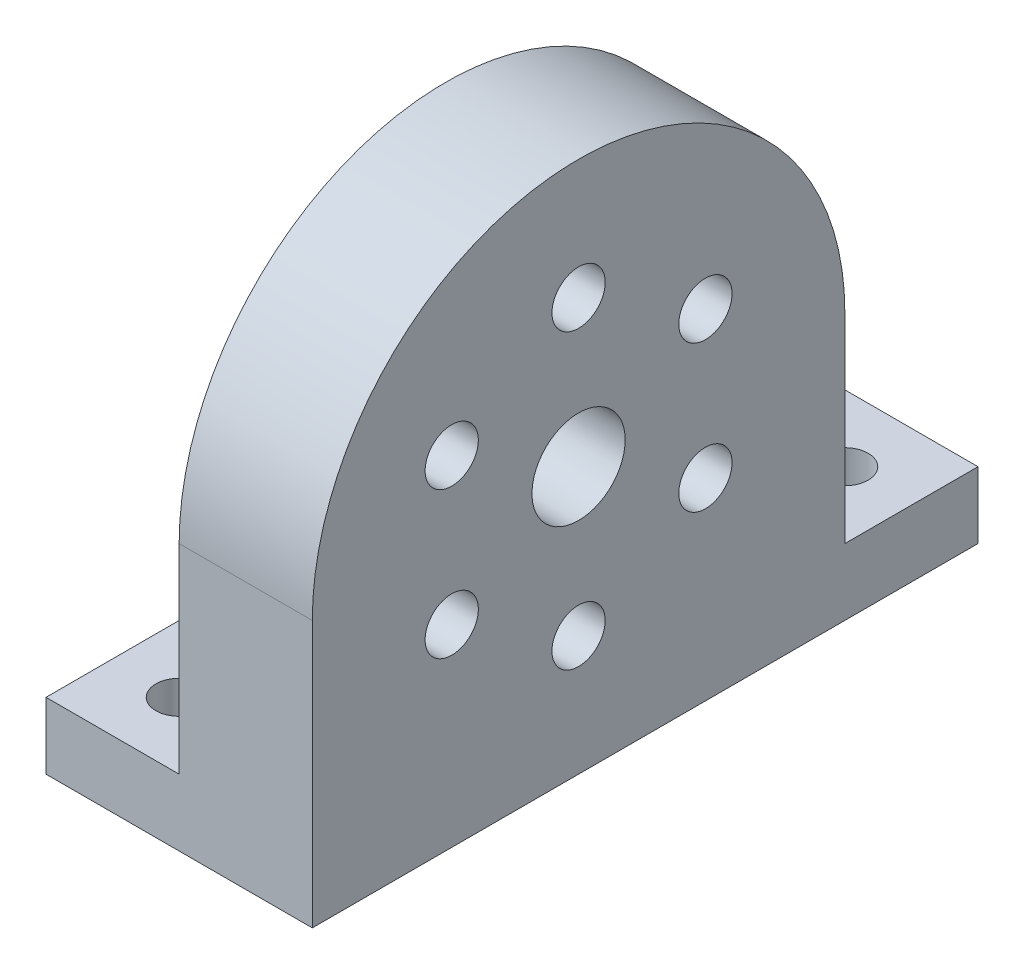
from build123d import *

# Parameters (mm, degrees)
SKETCH1_R                                       = 2
SKETCH1_R_2                                     = 3.5
BOSS_EXTRUDE1_DEPTH                             = 10
CSK_FOR_M2_FLAT_HEAD_MACHINE_SCREW1_D           = 3
CSK_FOR_M2_FLAT_HEAD_MACHINE_SCREW1_CSINK_D     = 5.6
CSK_FOR_M2_FLAT_HEAD_MACHINE_SCREW1_CSINK_ANGLE = 90
BOSS_EXTRUDE2_DEPTH                             = 5
F_3_0MM_DOWEL_HOLE1_D                           = 3.5


with BuildPart() as part:
    # Sketch1 → Boss-Extrude1 (new body)
    with BuildSketch(Plane(origin=(0, 0, 0), x_dir=(0, 0, -1), z_dir=(1, 0, 0))):
        with BuildLine():
            Line((30, -15), (20, -15))
            Line((20, -15), (20, 0))
            ThreePointArc((20, 0), (0, 20), (-20, 0))
            Line((-20, 0), (-20, -15))
            Line((-20, -15), (-20, -20))
            Line((-20, -20), (-15.856579477, -20))
            Line((-15.856579477, -20), (9.951007048, -20))
            Line((9.951007048, -20), (17.640087429, -20))
            Line((17.640087429, -20), (30, -20))
            Line((30, -20), (30, -15))
        make_face()
        with Locations((-9.526279442, -5.5)):
            Circle(SKETCH1_R, mode=Mode.SUBTRACT)
        with Locations((0, -11)):
            Circle(SKETCH1_R, mode=Mode.SUBTRACT)
        with Locations((9.526279442, -5.5)):
            Circle(SKETCH1_R, mode=Mode.SUBTRACT)
        with Locations((-9.526279442, 5.5)):
            Circle(SKETCH1_R, mode=Mode.SUBTRACT)
        Circle(SKETCH1_R_2, mode=Mode.SUBTRACT)
        with Locations((9.526279442, 5.5)):
            Circle(SKETCH1_R, mode=Mode.SUBTRACT)
        with Locations((0, 11)):
            Circle(SKETCH1_R, mode=Mode.SUBTRACT)
    extrude(amount=BOSS_EXTRUDE1_DEPTH)

    # CSK for M2 Flat Head Machine Screw1 (through all)
    with Locations(Plane.ZY):
        with Locations((0, 11), (9.526279442, 5.5), (9.526279442, -5.5), (0, -11), (-9.526279442, -5.5), (-9.526279442, 5.5)):
            CounterSinkHole(CSK_FOR_M2_FLAT_HEAD_MACHINE_SCREW1_D / 2, CSK_FOR_M2_FLAT_HEAD_MACHINE_SCREW1_CSINK_D / 2, counter_sink_angle=CSK_FOR_M2_FLAT_HEAD_MACHINE_SCREW1_CSINK_ANGLE)

    # Sketch6 → Boss-Extrude2 (add)
    with BuildSketch(Plane.XZ.offset(20)):
        Polygon((0, 20), (-10, 20), (-10, 10), (0, 10), (10, 10), (10, 20), align=None)
    extrude(amount=-BOSS_EXTRUDE2_DEPTH)

    # Ø3.0mm Dowel Hole1 (through all)
    with Locations(Plane(origin=(5, -15, -25), x_dir=(0, 0, 1), z_dir=(0, 1, 0))):
        with Locations((0, 0), (40, -10)):
            Hole(F_3_0MM_DOWEL_HOLE1_D / 2)


solid = part.part
